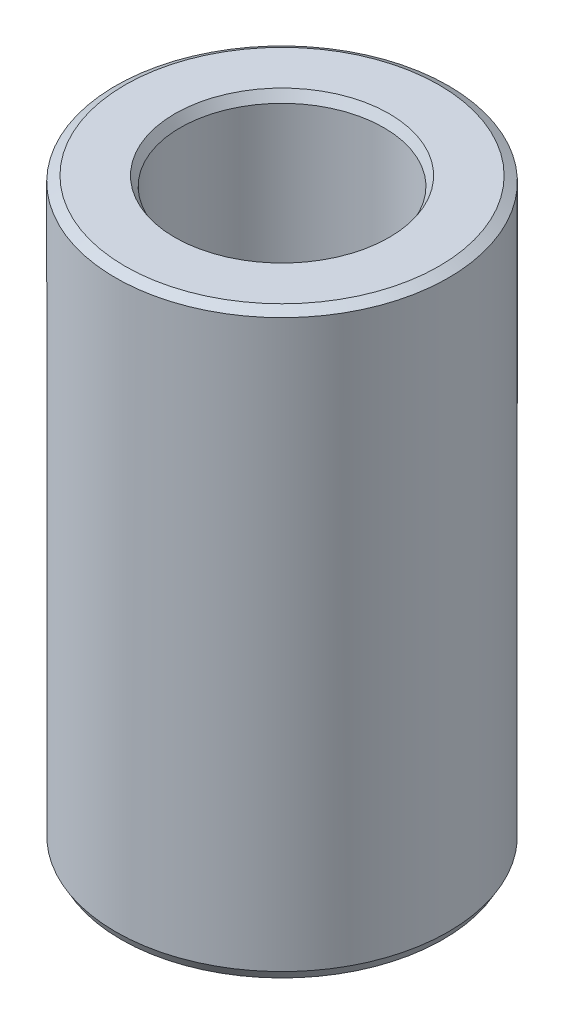
from build123d import *
from OCP.BRepFilletAPI import BRepFilletAPI_MakeChamfer

# Parameters (mm, degrees)
SKETCH1_R           = 45
BOSS_EXTRUDE1_DEPTH = 157.133923063
SKETCH2_R           = 27.523945673
CUT_EXTRUDE1_DEPTH  = 170.531913743
CHAMFER1_SIZE       = 1.462799839
CHAMFER1_SIZE2      = 2.533643642


with BuildPart() as part:
    # Sketch1 → Boss-Extrude1 (new body)
    with BuildSketch(Plane(origin=(0, 0, 0), x_dir=(1, 0, 0), z_dir=(0, 1, 0))):
        Circle(SKETCH1_R)
    extrude(amount=BOSS_EXTRUDE1_DEPTH)

    # Sketch2 → Cut-Extrude1 (cut, through all)
    with BuildSketch(Plane(origin=(0, 0, 0), x_dir=(1, 0, 0), z_dir=(0, 1, 0))):
        Circle(SKETCH2_R)
    extrude(amount=CUT_EXTRUDE1_DEPTH, mode=Mode.SUBTRACT)

    # Chamfer1: one chamfer whose edges measure the first distance from different faces: ONE call of the kernel's chamfer builder (chamfer() names one face for all edges)
    chamfer1_edges_1 = [part.edges().sort_by_distance(p)[0] for p in [
        (-27.523945673, 157.133923063, 0),
    ]]
    chamfer1_side_1 = [part.faces().sort_by_distance(p)[0] for p in [
        (-43.727207794, 157.133923063, 0),
    ]]
    chamfer1_edges_2 = [part.edges().sort_by_distance(p)[0] for p in [
        (-27.523945673, 0, 0),
    ]]
    chamfer1_side_2 = [part.faces().sort_by_distance(p)[0] for p in [
        (-27.523945673, 78.566961532, 0),
    ]]
    chamfer1_edges_3 = [part.edges().sort_by_distance(p)[0] for p in [
        (-45, 0, 0),
    ]]
    chamfer1_side_3 = [part.faces().sort_by_distance(p)[0] for p in [
        (-43.727207794, 0, 0),
    ]]
    chamfer1_edges_4 = [part.edges().sort_by_distance(p)[0] for p in [
        (-45, 157.133923063, 0),
    ]]
    chamfer1_side_4 = [part.faces().sort_by_distance(p)[0] for p in [
        (-45, 78.566961532, 0),
    ]]
    chamfer1 = BRepFilletAPI_MakeChamfer(part.part.solid().wrapped)
    for e in chamfer1_edges_1:
        chamfer1.Add(CHAMFER1_SIZE, CHAMFER1_SIZE2, e.wrapped, chamfer1_side_1[0].wrapped)  # the first distance lies on this face
    for e in chamfer1_edges_2:
        chamfer1.Add(CHAMFER1_SIZE, CHAMFER1_SIZE2, e.wrapped, chamfer1_side_2[0].wrapped)  # the first distance lies on this face
    for e in chamfer1_edges_3:
        chamfer1.Add(CHAMFER1_SIZE, CHAMFER1_SIZE2, e.wrapped, chamfer1_side_3[0].wrapped)  # the first distance lies on this face
    for e in chamfer1_edges_4:
        chamfer1.Add(CHAMFER1_SIZE, CHAMFER1_SIZE2, e.wrapped, chamfer1_side_4[0].wrapped)  # the first distance lies on this face
    add(Compound.cast(chamfer1.Shape()), mode=Mode.REPLACE)


solid = part.part
